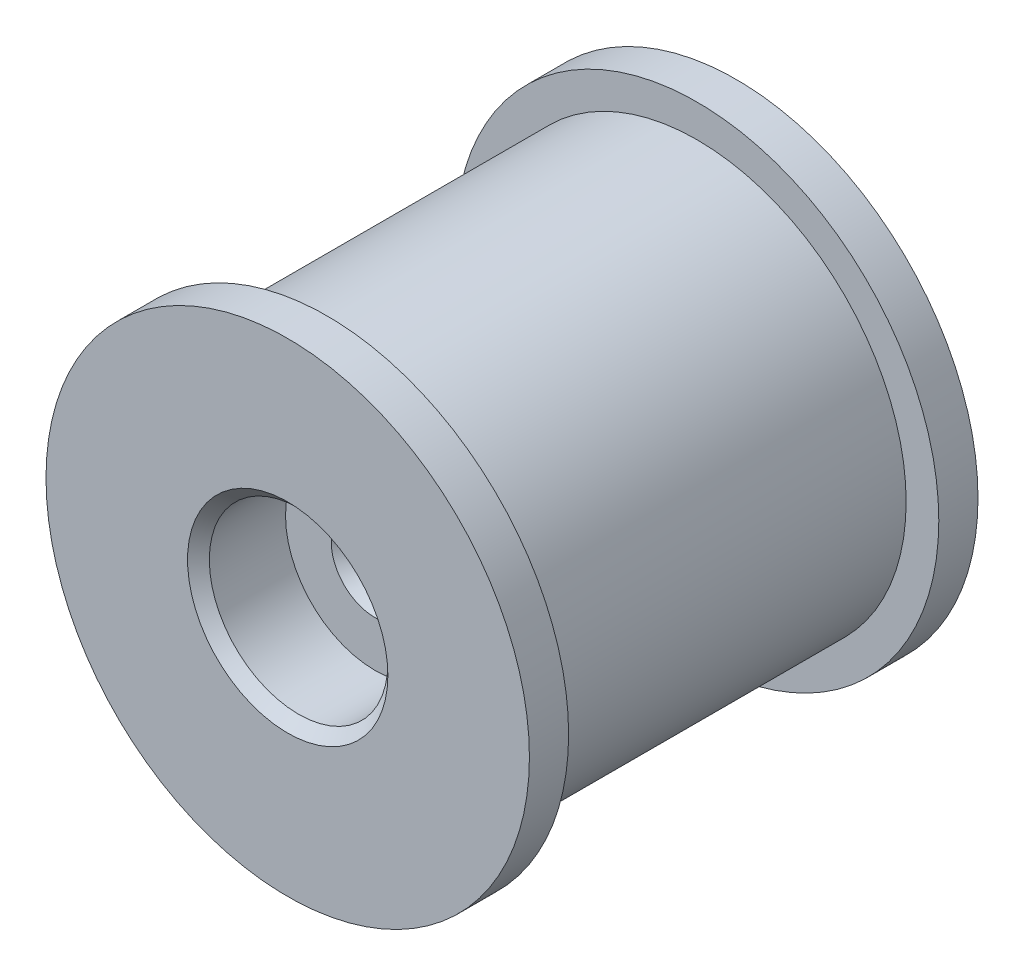
from build123d import *

# Parameters (mm, degrees)
AUFSATZ_LINEAR_AUSTRAGEN1_DEPTH      = 10.3
AUFSATZ_LINEAR_AUSTRAGEN1_DEPTH_BACK = 10.3
SKIZZE1_R                            = 9.6
SKIZZE2_R                            = 11.1
AUFSATZ_LINEAR_AUSTRAGEN2_DEPTH      = 1.8
AUFSATZ_LINEAR_START                 = -1.8
SKIZZE3_R                            = 11.1
AUFSATZ_LINEAR_AUSTRAGEN3_DEPTH      = 1.8
FASE1_SIZE                           = 0.5


with BuildPart() as part:
    # Skizze1 → Aufsatz-Linear austragen1 (new, two sides: drawn at the far end of the back side and taken through both)
    with BuildSketch(Plane.XY.offset(-AUFSATZ_LINEAR_AUSTRAGEN1_DEPTH_BACK)):
        Circle(SKIZZE1_R)
    extrude(amount=AUFSATZ_LINEAR_AUSTRAGEN1_DEPTH + AUFSATZ_LINEAR_AUSTRAGEN1_DEPTH_BACK)

    # Skizze2 → Aufsatz-Linear austragen2 (add)
    with BuildSketch(Plane.XY.offset(10.3)):
        Circle(SKIZZE2_R)
    extrude(amount=-AUFSATZ_LINEAR_AUSTRAGEN2_DEPTH)

    # Skizze3 → Aufsatz-Linear austragen3 (add)
    with BuildSketch(Plane(origin=(0, 0, -10.3), x_dir=(-1, 0, 0), z_dir=(0, 0, -1)).offset(AUFSATZ_LINEAR_START)):
        Circle(SKIZZE3_R)
    extrude(amount=AUFSATZ_LINEAR_AUSTRAGEN3_DEPTH)

    # Skizze8 → Schnitt-Rotation1 (revolve, cut)
    with BuildSketch(Plane(origin=(0, 0, 0), x_dir=(0, 0, -1), z_dir=(1, 0, 0))):
        Polygon((10.3, 0), (10.3, 8), (8.5, 8), (-3.7, 6), (-3.7, 1.5), (-6.3, 1.5), (-6.3, 4.1), (-10.3, 4.1), (-10.3, 0), align=None)
    revolve(axis=Axis((0, 0, -9.8), (0, 0, 1)), mode=Mode.SUBTRACT)

    # Fase1
    fase1_edges = [part.edges().sort_by_distance(p)[0] for p in [
        (0, -1.5, 6.3),
        (0, -1.5, 3.7),
        (0, -4.1, 10.3),
    ]]
    chamfer(fase1_edges, length=FASE1_SIZE)


solid = part.part
